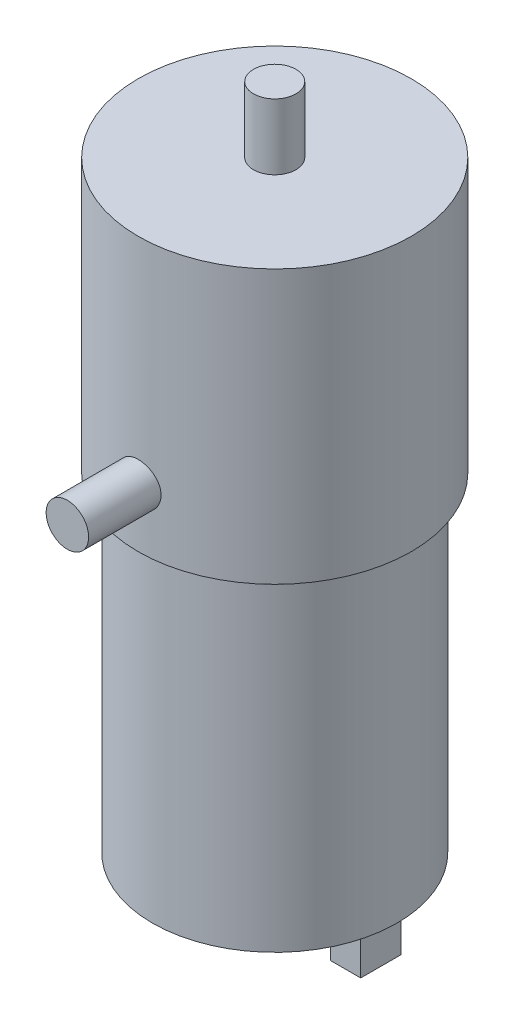
from build123d import *

# Parameters (mm, degrees)
ESQUISSE2_R        = 2.1
BOSS_EXTRU_1_DEPTH = 20.5
ESQUISSE3_W        = 3
ESQUISSE3_H        = 4
BOSS_EXTRU_2_DEPTH = 4.5


with BuildPart() as part:
    # Esquisse1 → Révolution1 (revolve)
    with BuildSketch(Plane.XY):
        with BuildLine():
            Line((0, 33.5), (0, -32.5))
            Line((0, -32.5), (12.1, -32.5))
            Line((12.1, -32.5), (12.1, -1))
            ThreePointArc((12.1, -1), (11.807106781, -0.292893219), (11.1, 0))
            Line((11.1, 0), (13.5, 0))
            Line((13.5, 0), (13.5, 27))
            Line((13.5, 27), (2.1, 27))
            Line((2.1, 27), (2.1, 33.5))
            Line((2.1, 33.5), (0, 33.5))
        make_face()
    revolve(axis=Axis((0, 44.171548117, 0), (0, -1, 0)))

    # Esquisse2 → Boss.-Extru.1 (add)
    with BuildSketch(Plane.XY):
        with Locations((0, 5.8)):
            Circle(ESQUISSE2_R)
    extrude(amount=BOSS_EXTRU_1_DEPTH)

    # Esquisse3 → Boss.-Extru.2 (add)
    with BuildSketch(Plane.XZ.offset(32.5)):
        with Locations((-9, 0)):
            Rectangle(ESQUISSE3_W, ESQUISSE3_H)
        with Locations((9, 0)):
            Rectangle(ESQUISSE3_W, ESQUISSE3_H)
    extrude(amount=BOSS_EXTRU_2_DEPTH)


solid = part.part
